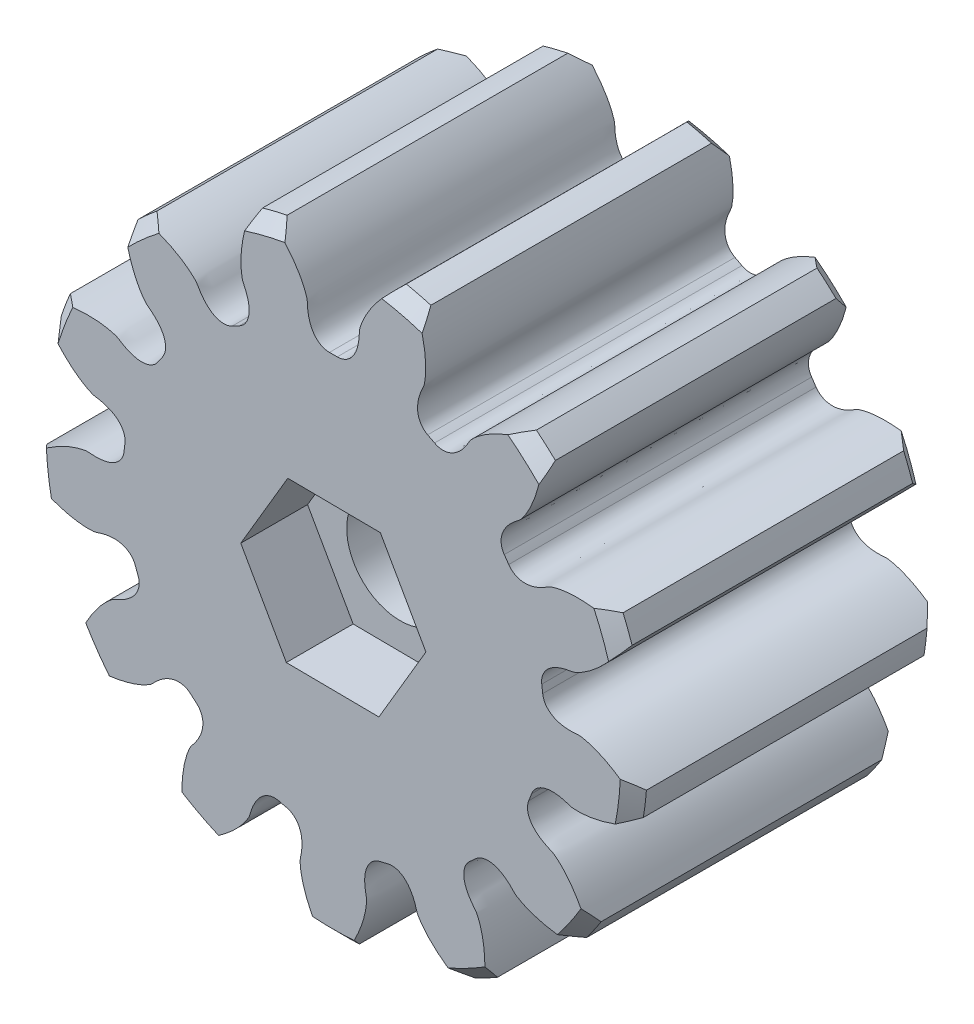
from build123d import *

# Parameters (mm, degrees)
GEAR_BASESKETCH_R                            = 11.250002953
F_1_5_MODULE_19_5000MM_P_D_DEPTH             = 5.75
ZKOSIT1_SIZE                                 = 0.5
TOOTH_CUT_START                              = -5.75
TOOTH_CUT_COARSE_PITCH_INVOLUTE_20_DEG_DEPTH = 11.5
KRUHOV_POLE1_COUNT                           = 13
SKETCH_1_R                                   = 2
CUT_EXTRUDE_1_DEPTH                          = 20.611077938
CUT_EXTRUDE_2_DEPTH                          = 2.5
SKETCH_4_R                                   = 6
CUT_EXTRUDE_4_DEPTH                          = 1.5


# Read off the part's stored shape, not the designer's step: Tooth-Cut, Coarse Pitch Involute 20 deg
with BuildPart() as part:
    # Gear-BaseSketch → 1.5 Module, 19,5000mm P.D. (new, symmetric)
    with BuildSketch(Plane.XY):
        Circle(GEAR_BASESKETCH_R)
    extrude(amount=F_1_5_MODULE_19_5000MM_P_D_DEPTH, both=True)

    # Zkosit1
    zkosit1_edges = [part.edges().sort_by_distance(p)[0] for p in [
        (-11.250002953, 0, -5.75),
        (-11.250002953, 0, 5.75),
    ]]
    chamfer(zkosit1_edges, length=ZKOSIT1_SIZE)

    # Tooth-Cut_ Coarse Pitch Involute 20  2 → Tooth-Cut, Coarse Pitch Involute 20 deg (cut)
    with BuildSketch(Plane.XY.offset(TOOTH_CUT_START)):
        with BuildLine():
            ThreePointArc((2.229013615, 11.026969881), (0, 11.250002953), (-2.229013615, 11.026969881))
            add(Edge.make_bspline(
                [(-2.229013615, 11.026969881), (-2.177555627, 10.978678496), (-2.056098911, 10.863106145), (-1.878665921, 10.676206256), (-1.70194877, 10.472343854), (-1.54878756, 10.276988801), (-1.417710704, 10.092094881), (-1.30735681, 9.919259219), (-1.216220205, 9.760023456), (-1.142664207, 9.615801741), (-1.085099993, 9.487870442), (-1.041440105, 9.377423061), (-1.010722649, 9.285381048), (-0.962740843, 9.127627384), (-0.97145931, 8.966952618), (-0.952755282, 8.810948275), (-0.941717541, 8.737079381), (-0.923547701, 8.642684628), (-0.894523294, 8.52964445), (-0.848213992, 8.400861937), (-0.789508829, 8.280040678), (-0.715999475, 8.167154389), (-0.624006135, 8.063356466), (-0.509023396, 7.972649243), (-0.368382511, 7.903532201), (-0.241928528, 7.87688895), (-0.166187034, 7.874333138), (-0.145824902, 7.87364604)],
                knots=[0.024789489, 0.024789489, 0.024789489, 0.024789489, 0.076650381, 0.14801453, 0.214092446, 0.274884129, 0.330389579, 0.380608797, 0.425541782, 0.465188536, 0.499549057, 0.528623346, 0.552411404, 0.570913232, 0.649428122, 0.668178916, 0.68645917, 0.70430117, 0.738818518, 0.772119728, 0.804724696, 0.837331461, 0.870831852, 0.906227014, 0.944304702, 0.985027032, 1, 1, 1, 1], degree=3))
            ThreePointArc((-0.145824902, 7.87364604), (0, 7.874996309), (0.145824902, 7.87364604))
            add(Edge.make_bspline(
                [(0.145824902, 7.87364604), (0.166187034, 7.874333138), (0.241928528, 7.87688895), (0.368382511, 7.903532201), (0.509023396, 7.972649243), (0.624006135, 8.063356466), (0.715999475, 8.167154389), (0.789508829, 8.280040678), (0.848213992, 8.400861937), (0.894523294, 8.52964445), (0.923547701, 8.642684628), (0.941717541, 8.737079381), (0.952755282, 8.810948275), (0.97145931, 8.966952618), (0.962740843, 9.127627384), (1.010722649, 9.285381048), (1.041440105, 9.377423061), (1.085099993, 9.487870442), (1.142664207, 9.615801741), (1.216220205, 9.760023456), (1.30735681, 9.919259219), (1.417710704, 10.092094881), (1.54878756, 10.276988801), (1.70194877, 10.472343854), (1.878665921, 10.676206256), (2.056098911, 10.863106145), (2.177555627, 10.978678496), (2.229013615, 11.026969881)],
                knots=[0, 0, 0, 0, 0.014972968, 0.055695298, 0.093772986, 0.129168148, 0.162668539, 0.195275304, 0.227880272, 0.261181482, 0.29569883, 0.31354083, 0.331821084, 0.350571878, 0.429086768, 0.447588596, 0.471376654, 0.500450943, 0.534811464, 0.574458218, 0.619391203, 0.669610421, 0.725115871, 0.785907554, 0.85198547, 0.923349619, 0.975210511, 0.975210511, 0.975210511, 0.975210511], degree=3))
        make_face()
    tooth_cut_coarse_pitch_involute_20_deg = extrude(amount=TOOTH_CUT_COARSE_PITCH_INVOLUTE_20_DEG_DEPTH, mode=Mode.SUBTRACT)

    # Kruhové pole1: Tooth-Cut, Coarse Pitch Involute 20 deg ×13 about axis
    kruhov_pole1_axis = Axis((0, 0, -88.99), (0, 0, 1))
    for i in range(1, KRUHOV_POLE1_COUNT):
        add(tooth_cut_coarse_pitch_involute_20_deg.rotate(kruhov_pole1_axis, i * 360 / KRUHOV_POLE1_COUNT), mode=Mode.SUBTRACT)

    # Эскиз1 → Вырез-Вытянуть1 (cut, through all)
    with BuildSketch(Plane.XY.offset(5.75)):
        Circle(SKETCH_1_R)
    extrude(amount=-CUT_EXTRUDE_1_DEPTH, mode=Mode.SUBTRACT)

    # Эскиз2 → Вырез-Вытянуть2 (cut)
    with BuildSketch(Plane.XY.offset(5.75)):
        Polygon((1.704536338, -3.015718136), (3.463956685, -0.031687298), (1.759420347, 2.984030838), (-1.704536338, 3.015718136), (-3.463956685, 0.031687298), (-1.759420347, -2.984030838), align=None)
    extrude(amount=-CUT_EXTRUDE_2_DEPTH, mode=Mode.SUBTRACT)

    # Эскиз4 → Вырез-Вытянуть4 (cut)
    with BuildSketch(Plane(origin=(0, 0, -5.75), x_dir=(-1, 0, 0), z_dir=(0, 0, -1))):
        Circle(SKETCH_4_R)
    extrude(amount=-CUT_EXTRUDE_4_DEPTH, mode=Mode.SUBTRACT)


solid = part.part
